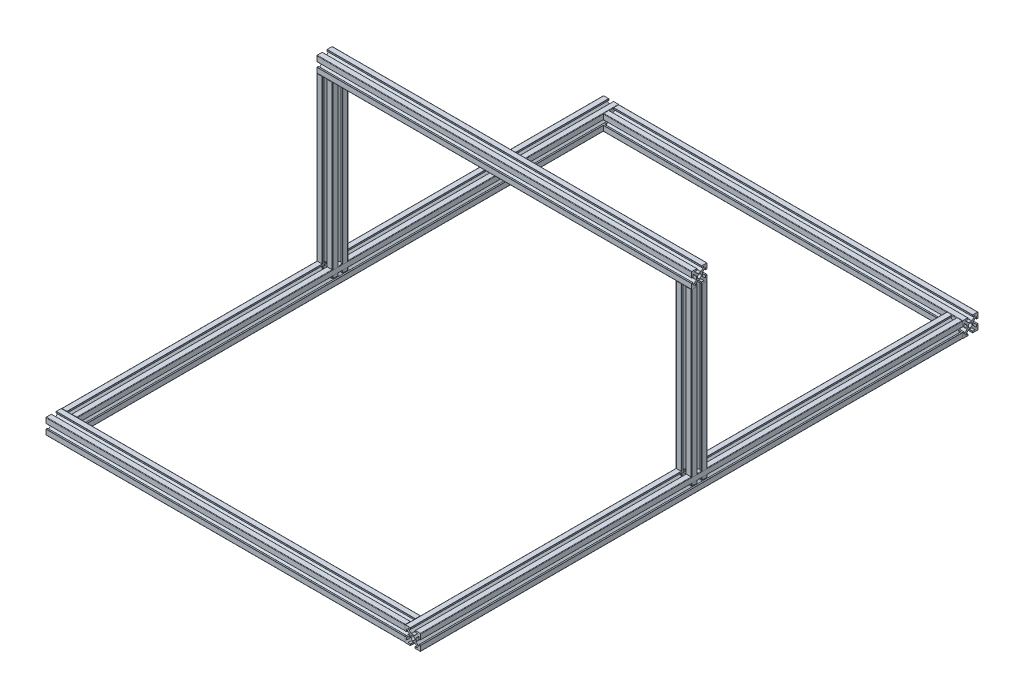
from build123d import *

# Parameters (mm, degrees)
T_SLOT_1010EXTXRUSION_1_DEPTH       = 352
T_SLOT_1010EXTXRUSION_1_DEPTH_BACK  = 1
SKETCH11_R                          = 1.25
SKETCH11_ON_SEGMENT_2_R             = 1.25
T_SLOT_1010EXTXRUSION_1_2_DEPTH     = 236
SKETCH11_ON_SEGMENT_3_R             = 1.25
T_SLOT_1010EXTXRUSION_1_3_DEPTH     = 353
SKETCH11_ON_SEGMENT_4_R             = 1.25
T_SLOT_1010EXTXRUSION_1_4_DEPTH     = 236
T_SLOT_1010EXTXRUSION_2_OUTLINE_R   = 1.25
T_SLOT_1010EXTXRUSION_2_DEPTH       = 109
T_SLOT_START                        = -120
T_SLOT_1010EXTXRUSION_2_2_OUTLINE_R = 1.25
T_SLOT_1010EXTXRUSION_2_2_DEPTH     = 240


# Read off the part's stored shape, not the designer's step: T-slot 1010EXTXRUSION(2)
with BuildPart() as part:
    # Sketch11 → T-slot 1010EXTXRUSION(1) (new, two sides: drawn at the far end of the back side and taken through both)
    with BuildSketch(Plane(origin=(-115, 0, 173.5), x_dir=(-1, 0, 0), z_dir=(0, 0, -1)).offset(-T_SLOT_1010EXTXRUSION_1_DEPTH_BACK)):
        with BuildLine():
            Line((-1.5, -4.1), (-1.5, -4.9))
            ThreePointArc((-1.5, -4.9), (-1.529289322, -4.970710678), (-1.6, -5))
            Line((-1.6, -5), (-4.7, -5))
            ThreePointArc((-4.7, -5), (-4.912132034, -4.912132034), (-5, -4.7))
            Line((-5, -4.7), (-5, -1.6))
            ThreePointArc((-5, -1.6), (-4.970710678, -1.529289322), (-4.9, -1.5))
            Line((-4.9, -1.5), (-4.1, -1.5))
            ThreePointArc((-4.1, -1.5), (-4.029289322, -1.529289322), (-4, -1.6))
            Line((-4, -1.6), (-4, -3.080761184))
            Line((-4, -3.080761184), (-2.067157288, -1.147918472))
            ThreePointArc((-2.067157288, -1.147918472), (-1.980448187, -1.018149132), (-1.95, -0.86507576))
            Line((-1.95, -0.86507576), (-1.95, 0.86507576))
            ThreePointArc((-1.95, 0.86507576), (-1.980448187, 1.018149132), (-2.067157288, 1.147918472))
            Line((-2.067157288, 1.147918472), (-3.94820158, 3.028962765))
            Line((-3.94820158, 3.028962765), (-4.000065469, 1.596382058))
            ThreePointArc((-4.000065469, 1.596382058), (-4.030580241, 1.528021551), (-4.1, 1.5))
            Line((-4.1, 1.5), (-4.9, 1.5))
            ThreePointArc((-4.9, 1.5), (-4.970710678, 1.529289322), (-5, 1.6))
            Line((-5, 1.6), (-5, 4.7))
            ThreePointArc((-5, 4.7), (-4.912132034, 4.912132034), (-4.7, 5))
            Line((-4.7, 5), (-1.6, 5))
            ThreePointArc((-1.6, 5), (-1.529289322, 4.970710678), (-1.5, 4.9))
            Line((-1.5, 4.9), (-1.5, 4.1))
            ThreePointArc((-1.5, 4.1), (-1.529289322, 4.029289322), (-1.6, 4))
            Line((-1.6, 4), (-3.080761184, 4))
            Line((-3.080761184, 4), (-1.147918472, 2.067157288))
            ThreePointArc((-1.147918472, 2.067157288), (-1.018149132, 1.980448187), (-0.86507576, 1.95))
            Line((-0.86507576, 1.95), (0.86507576, 1.95))
            ThreePointArc((0.86507576, 1.95), (1.018149132, 1.980448187), (1.147918472, 2.067157288))
            Line((1.147918472, 2.067157288), (3.080761184, 4))
            Line((3.080761184, 4), (1.6, 4))
            ThreePointArc((1.6, 4), (1.529289322, 4.029289322), (1.5, 4.1))
            Line((1.5, 4.1), (1.5, 4.9))
            ThreePointArc((1.5, 4.9), (1.529289322, 4.970710678), (1.6, 5))
            Line((1.6, 5), (4.7, 5))
            ThreePointArc((4.7, 5), (4.912132034, 4.912132034), (5, 4.7))
            Line((5, 4.7), (5, 1.6))
            ThreePointArc((5, 1.6), (4.970710678, 1.529289322), (4.9, 1.5))
            Line((4.9, 1.5), (4.1, 1.5))
            ThreePointArc((4.1, 1.5), (4.029289322, 1.529289322), (4, 1.6))
            Line((4, 1.6), (4, 3.080761184))
            Line((4, 3.080761184), (2.067157288, 1.147918472))
            ThreePointArc((2.067157288, 1.147918472), (1.980448187, 1.018149132), (1.95, 0.86507576))
            Line((1.95, 0.86507576), (1.95, -0.86507576))
            ThreePointArc((1.95, -0.86507576), (1.980448187, -1.018149132), (2.067157288, -1.147918472))
            Line((2.067157288, -1.147918472), (4, -3.080761184))
            Line((4, -3.080761184), (4, -1.6))
            ThreePointArc((4, -1.6), (4.029289322, -1.529289322), (4.1, -1.5))
            Line((4.1, -1.5), (4.9, -1.5))
            ThreePointArc((4.9, -1.5), (4.970710678, -1.529289322), (5, -1.6))
            Line((5, -1.6), (5, -4.7))
            ThreePointArc((5, -4.7), (4.912132034, -4.912132034), (4.7, -5))
            Line((4.7, -5), (1.6, -5))
            ThreePointArc((1.6, -5), (1.529289322, -4.970710678), (1.5, -4.9))
            Line((1.5, -4.9), (1.5, -4.1))
            ThreePointArc((1.5, -4.1), (1.529289322, -4.029289322), (1.6, -4))
            Line((1.6, -4), (3.080761184, -4))
            Line((3.080761184, -4), (1.147918472, -2.067157288))
            ThreePointArc((1.147918472, -2.067157288), (1.018149132, -1.980448187), (0.86507576, -1.95))
            Line((0.86507576, -1.95), (-0.86507576, -1.95))
            ThreePointArc((-0.86507576, -1.95), (-1.018149132, -1.980448187), (-1.147918472, -2.067157288))
            Line((-1.147918472, -2.067157288), (-3.080761184, -4))
            Line((-3.080761184, -4), (-1.6, -4))
            ThreePointArc((-1.6, -4), (-1.529289322, -4.029289322), (-1.5, -4.1))
        make_face()
        Circle(SKETCH11_R, mode=Mode.SUBTRACT)
    extrude(amount=T_SLOT_1010EXTXRUSION_1_DEPTH + T_SLOT_1010EXTXRUSION_1_DEPTH_BACK)

    # T-slot 1010EXTXRUSION(1) end butt 1
    split(bisect_by=Plane(origin=(-115, 0, 168.5), x_dir=(0, 1, 0), z_dir=(0, 0, -1)), keep=Keep.TOP)


with BuildPart() as body_2:
    # Sketch11 on segment 2 (carried to segment 2) → T-slot 1010EXTXRUSION_1 2 (new body)
    with BuildSketch(Plane(origin=(-116, 0, -173.5), x_dir=(0, 0, -1), z_dir=(1, 0, 0))):
        with BuildLine():
            Line((-1.5, -4.1), (-1.5, -4.9))
            ThreePointArc((-1.5, -4.9), (-1.529289322, -4.970710678), (-1.6, -5))
            Line((-1.6, -5), (-4.7, -5))
            ThreePointArc((-4.7, -5), (-4.912132034, -4.912132034), (-5, -4.7))
            Line((-5, -4.7), (-5, -1.6))
            ThreePointArc((-5, -1.6), (-4.970710678, -1.529289322), (-4.9, -1.5))
            Line((-4.9, -1.5), (-4.1, -1.5))
            ThreePointArc((-4.1, -1.5), (-4.029289322, -1.529289322), (-4, -1.6))
            Line((-4, -1.6), (-4, -3.080761184))
            Line((-4, -3.080761184), (-2.067157288, -1.147918472))
            ThreePointArc((-2.067157288, -1.147918472), (-1.980448187, -1.018149132), (-1.95, -0.86507576))
            Line((-1.95, -0.86507576), (-1.95, 0.86507576))
            ThreePointArc((-1.95, 0.86507576), (-1.980448187, 1.018149132), (-2.067157288, 1.147918472))
            Line((-2.067157288, 1.147918472), (-3.94820158, 3.028962765))
            Line((-3.94820158, 3.028962765), (-4.000065469, 1.596382058))
            ThreePointArc((-4.000065469, 1.596382058), (-4.030580241, 1.528021551), (-4.1, 1.5))
            Line((-4.1, 1.5), (-4.9, 1.5))
            ThreePointArc((-4.9, 1.5), (-4.970710678, 1.529289322), (-5, 1.6))
            Line((-5, 1.6), (-5, 4.7))
            ThreePointArc((-5, 4.7), (-4.912132034, 4.912132034), (-4.7, 5))
            Line((-4.7, 5), (-1.6, 5))
            ThreePointArc((-1.6, 5), (-1.529289322, 4.970710678), (-1.5, 4.9))
            Line((-1.5, 4.9), (-1.5, 4.1))
            ThreePointArc((-1.5, 4.1), (-1.529289322, 4.029289322), (-1.6, 4))
            Line((-1.6, 4), (-3.080761184, 4))
            Line((-3.080761184, 4), (-1.147918472, 2.067157288))
            ThreePointArc((-1.147918472, 2.067157288), (-1.018149132, 1.980448187), (-0.86507576, 1.95))
            Line((-0.86507576, 1.95), (0.86507576, 1.95))
            ThreePointArc((0.86507576, 1.95), (1.018149132, 1.980448187), (1.147918472, 2.067157288))
            Line((1.147918472, 2.067157288), (3.080761184, 4))
            Line((3.080761184, 4), (1.6, 4))
            ThreePointArc((1.6, 4), (1.529289322, 4.029289322), (1.5, 4.1))
            Line((1.5, 4.1), (1.5, 4.9))
            ThreePointArc((1.5, 4.9), (1.529289322, 4.970710678), (1.6, 5))
            Line((1.6, 5), (4.7, 5))
            ThreePointArc((4.7, 5), (4.912132034, 4.912132034), (5, 4.7))
            Line((5, 4.7), (5, 1.6))
            ThreePointArc((5, 1.6), (4.970710678, 1.529289322), (4.9, 1.5))
            Line((4.9, 1.5), (4.1, 1.5))
            ThreePointArc((4.1, 1.5), (4.029289322, 1.529289322), (4, 1.6))
            Line((4, 1.6), (4, 3.080761184))
            Line((4, 3.080761184), (2.067157288, 1.147918472))
            ThreePointArc((2.067157288, 1.147918472), (1.980448187, 1.018149132), (1.95, 0.86507576))
            Line((1.95, 0.86507576), (1.95, -0.86507576))
            ThreePointArc((1.95, -0.86507576), (1.980448187, -1.018149132), (2.067157288, -1.147918472))
            Line((2.067157288, -1.147918472), (4, -3.080761184))
            Line((4, -3.080761184), (4, -1.6))
            ThreePointArc((4, -1.6), (4.029289322, -1.529289322), (4.1, -1.5))
            Line((4.1, -1.5), (4.9, -1.5))
            ThreePointArc((4.9, -1.5), (4.970710678, -1.529289322), (5, -1.6))
            Line((5, -1.6), (5, -4.7))
            ThreePointArc((5, -4.7), (4.912132034, -4.912132034), (4.7, -5))
            Line((4.7, -5), (1.6, -5))
            ThreePointArc((1.6, -5), (1.529289322, -4.970710678), (1.5, -4.9))
            Line((1.5, -4.9), (1.5, -4.1))
            ThreePointArc((1.5, -4.1), (1.529289322, -4.029289322), (1.6, -4))
            Line((1.6, -4), (3.080761184, -4))
            Line((3.080761184, -4), (1.147918472, -2.067157288))
            ThreePointArc((1.147918472, -2.067157288), (1.018149132, -1.980448187), (0.86507576, -1.95))
            Line((0.86507576, -1.95), (-0.86507576, -1.95))
            ThreePointArc((-0.86507576, -1.95), (-1.018149132, -1.980448187), (-1.147918472, -2.067157288))
            Line((-1.147918472, -2.067157288), (-3.080761184, -4))
            Line((-3.080761184, -4), (-1.6, -4))
            ThreePointArc((-1.6, -4), (-1.529289322, -4.029289322), (-1.5, -4.1))
        make_face()
        Circle(SKETCH11_ON_SEGMENT_2_R, mode=Mode.SUBTRACT)
    extrude(amount=T_SLOT_1010EXTXRUSION_1_2_DEPTH)

    # T-slot 1010EXTXRUSION_1 2 end butt 1
    split(bisect_by=Plane(origin=(-110, 0, -173.5), x_dir=(0, 1, 0), z_dir=(1, 0, 0)), keep=Keep.TOP)


with BuildPart() as body_3:
    # Sketch11 on segment 3 (carried to segment 3) → T-slot 1010EXTXRUSION_1 3 (new body)
    with BuildSketch(Plane(origin=(115, 0, -174.5), x_dir=(1, 0, 0), z_dir=(0, 0, 1))):
        with BuildLine():
            Line((-1.5, -4.1), (-1.5, -4.9))
            ThreePointArc((-1.5, -4.9), (-1.529289322, -4.970710678), (-1.6, -5))
            Line((-1.6, -5), (-4.7, -5))
            ThreePointArc((-4.7, -5), (-4.912132034, -4.912132034), (-5, -4.7))
            Line((-5, -4.7), (-5, -1.6))
            ThreePointArc((-5, -1.6), (-4.970710678, -1.529289322), (-4.9, -1.5))
            Line((-4.9, -1.5), (-4.1, -1.5))
            ThreePointArc((-4.1, -1.5), (-4.029289322, -1.529289322), (-4, -1.6))
            Line((-4, -1.6), (-4, -3.080761184))
            Line((-4, -3.080761184), (-2.067157288, -1.147918472))
            ThreePointArc((-2.067157288, -1.147918472), (-1.980448187, -1.018149132), (-1.95, -0.86507576))
            Line((-1.95, -0.86507576), (-1.95, 0.86507576))
            ThreePointArc((-1.95, 0.86507576), (-1.980448187, 1.018149132), (-2.067157288, 1.147918472))
            Line((-2.067157288, 1.147918472), (-3.94820158, 3.028962765))
            Line((-3.94820158, 3.028962765), (-4.000065469, 1.596382058))
            ThreePointArc((-4.000065469, 1.596382058), (-4.030580241, 1.528021551), (-4.1, 1.5))
            Line((-4.1, 1.5), (-4.9, 1.5))
            ThreePointArc((-4.9, 1.5), (-4.970710678, 1.529289322), (-5, 1.6))
            Line((-5, 1.6), (-5, 4.7))
            ThreePointArc((-5, 4.7), (-4.912132034, 4.912132034), (-4.7, 5))
            Line((-4.7, 5), (-1.6, 5))
            ThreePointArc((-1.6, 5), (-1.529289322, 4.970710678), (-1.5, 4.9))
            Line((-1.5, 4.9), (-1.5, 4.1))
            ThreePointArc((-1.5, 4.1), (-1.529289322, 4.029289322), (-1.6, 4))
            Line((-1.6, 4), (-3.080761184, 4))
            Line((-3.080761184, 4), (-1.147918472, 2.067157288))
            ThreePointArc((-1.147918472, 2.067157288), (-1.018149132, 1.980448187), (-0.86507576, 1.95))
            Line((-0.86507576, 1.95), (0.86507576, 1.95))
            ThreePointArc((0.86507576, 1.95), (1.018149132, 1.980448187), (1.147918472, 2.067157288))
            Line((1.147918472, 2.067157288), (3.080761184, 4))
            Line((3.080761184, 4), (1.6, 4))
            ThreePointArc((1.6, 4), (1.529289322, 4.029289322), (1.5, 4.1))
            Line((1.5, 4.1), (1.5, 4.9))
            ThreePointArc((1.5, 4.9), (1.529289322, 4.970710678), (1.6, 5))
            Line((1.6, 5), (4.7, 5))
            ThreePointArc((4.7, 5), (4.912132034, 4.912132034), (5, 4.7))
            Line((5, 4.7), (5, 1.6))
            ThreePointArc((5, 1.6), (4.970710678, 1.529289322), (4.9, 1.5))
            Line((4.9, 1.5), (4.1, 1.5))
            ThreePointArc((4.1, 1.5), (4.029289322, 1.529289322), (4, 1.6))
            Line((4, 1.6), (4, 3.080761184))
            Line((4, 3.080761184), (2.067157288, 1.147918472))
            ThreePointArc((2.067157288, 1.147918472), (1.980448187, 1.018149132), (1.95, 0.86507576))
            Line((1.95, 0.86507576), (1.95, -0.86507576))
            ThreePointArc((1.95, -0.86507576), (1.980448187, -1.018149132), (2.067157288, -1.147918472))
            Line((2.067157288, -1.147918472), (4, -3.080761184))
            Line((4, -3.080761184), (4, -1.6))
            ThreePointArc((4, -1.6), (4.029289322, -1.529289322), (4.1, -1.5))
            Line((4.1, -1.5), (4.9, -1.5))
            ThreePointArc((4.9, -1.5), (4.970710678, -1.529289322), (5, -1.6))
            Line((5, -1.6), (5, -4.7))
            ThreePointArc((5, -4.7), (4.912132034, -4.912132034), (4.7, -5))
            Line((4.7, -5), (1.6, -5))
            ThreePointArc((1.6, -5), (1.529289322, -4.970710678), (1.5, -4.9))
            Line((1.5, -4.9), (1.5, -4.1))
            ThreePointArc((1.5, -4.1), (1.529289322, -4.029289322), (1.6, -4))
            Line((1.6, -4), (3.080761184, -4))
            Line((3.080761184, -4), (1.147918472, -2.067157288))
            ThreePointArc((1.147918472, -2.067157288), (1.018149132, -1.980448187), (0.86507576, -1.95))
            Line((0.86507576, -1.95), (-0.86507576, -1.95))
            ThreePointArc((-0.86507576, -1.95), (-1.018149132, -1.980448187), (-1.147918472, -2.067157288))
            Line((-1.147918472, -2.067157288), (-3.080761184, -4))
            Line((-3.080761184, -4), (-1.6, -4))
            ThreePointArc((-1.6, -4), (-1.529289322, -4.029289322), (-1.5, -4.1))
        make_face()
        Circle(SKETCH11_ON_SEGMENT_3_R, mode=Mode.SUBTRACT)
    extrude(amount=T_SLOT_1010EXTXRUSION_1_3_DEPTH)

    # T-slot 1010EXTXRUSION_1 3 end butt 1
    split(bisect_by=Plane(origin=(115, 0, -168.5), x_dir=(0, -1, 0), z_dir=(0, 0, 1)), keep=Keep.TOP)


with BuildPart() as body_4:
    # Sketch11 on segment 4 (carried to segment 4) → T-slot 1010EXTXRUSION_1 4 (new body)
    with BuildSketch(Plane(origin=(116, 0, 173.5), x_dir=(0, 0, 1), z_dir=(-1, 0, 0))):
        with BuildLine():
            Line((-1.5, -4.1), (-1.5, -4.9))
            ThreePointArc((-1.5, -4.9), (-1.529289322, -4.970710678), (-1.6, -5))
            Line((-1.6, -5), (-4.7, -5))
            ThreePointArc((-4.7, -5), (-4.912132034, -4.912132034), (-5, -4.7))
            Line((-5, -4.7), (-5, -1.6))
            ThreePointArc((-5, -1.6), (-4.970710678, -1.529289322), (-4.9, -1.5))
            Line((-4.9, -1.5), (-4.1, -1.5))
            ThreePointArc((-4.1, -1.5), (-4.029289322, -1.529289322), (-4, -1.6))
            Line((-4, -1.6), (-4, -3.080761184))
            Line((-4, -3.080761184), (-2.067157288, -1.147918472))
            ThreePointArc((-2.067157288, -1.147918472), (-1.980448187, -1.018149132), (-1.95, -0.86507576))
            Line((-1.95, -0.86507576), (-1.95, 0.86507576))
            ThreePointArc((-1.95, 0.86507576), (-1.980448187, 1.018149132), (-2.067157288, 1.147918472))
            Line((-2.067157288, 1.147918472), (-3.94820158, 3.028962765))
            Line((-3.94820158, 3.028962765), (-4.000065469, 1.596382058))
            ThreePointArc((-4.000065469, 1.596382058), (-4.030580241, 1.528021551), (-4.1, 1.5))
            Line((-4.1, 1.5), (-4.9, 1.5))
            ThreePointArc((-4.9, 1.5), (-4.970710678, 1.529289322), (-5, 1.6))
            Line((-5, 1.6), (-5, 4.7))
            ThreePointArc((-5, 4.7), (-4.912132034, 4.912132034), (-4.7, 5))
            Line((-4.7, 5), (-1.6, 5))
            ThreePointArc((-1.6, 5), (-1.529289322, 4.970710678), (-1.5, 4.9))
            Line((-1.5, 4.9), (-1.5, 4.1))
            ThreePointArc((-1.5, 4.1), (-1.529289322, 4.029289322), (-1.6, 4))
            Line((-1.6, 4), (-3.080761184, 4))
            Line((-3.080761184, 4), (-1.147918472, 2.067157288))
            ThreePointArc((-1.147918472, 2.067157288), (-1.018149132, 1.980448187), (-0.86507576, 1.95))
            Line((-0.86507576, 1.95), (0.86507576, 1.95))
            ThreePointArc((0.86507576, 1.95), (1.018149132, 1.980448187), (1.147918472, 2.067157288))
            Line((1.147918472, 2.067157288), (3.080761184, 4))
            Line((3.080761184, 4), (1.6, 4))
            ThreePointArc((1.6, 4), (1.529289322, 4.029289322), (1.5, 4.1))
            Line((1.5, 4.1), (1.5, 4.9))
            ThreePointArc((1.5, 4.9), (1.529289322, 4.970710678), (1.6, 5))
            Line((1.6, 5), (4.7, 5))
            ThreePointArc((4.7, 5), (4.912132034, 4.912132034), (5, 4.7))
            Line((5, 4.7), (5, 1.6))
            ThreePointArc((5, 1.6), (4.970710678, 1.529289322), (4.9, 1.5))
            Line((4.9, 1.5), (4.1, 1.5))
            ThreePointArc((4.1, 1.5), (4.029289322, 1.529289322), (4, 1.6))
            Line((4, 1.6), (4, 3.080761184))
            Line((4, 3.080761184), (2.067157288, 1.147918472))
            ThreePointArc((2.067157288, 1.147918472), (1.980448187, 1.018149132), (1.95, 0.86507576))
            Line((1.95, 0.86507576), (1.95, -0.86507576))
            ThreePointArc((1.95, -0.86507576), (1.980448187, -1.018149132), (2.067157288, -1.147918472))
            Line((2.067157288, -1.147918472), (4, -3.080761184))
            Line((4, -3.080761184), (4, -1.6))
            ThreePointArc((4, -1.6), (4.029289322, -1.529289322), (4.1, -1.5))
            Line((4.1, -1.5), (4.9, -1.5))
            ThreePointArc((4.9, -1.5), (4.970710678, -1.529289322), (5, -1.6))
            Line((5, -1.6), (5, -4.7))
            ThreePointArc((5, -4.7), (4.912132034, -4.912132034), (4.7, -5))
            Line((4.7, -5), (1.6, -5))
            ThreePointArc((1.6, -5), (1.529289322, -4.970710678), (1.5, -4.9))
            Line((1.5, -4.9), (1.5, -4.1))
            ThreePointArc((1.5, -4.1), (1.529289322, -4.029289322), (1.6, -4))
            Line((1.6, -4), (3.080761184, -4))
            Line((3.080761184, -4), (1.147918472, -2.067157288))
            ThreePointArc((1.147918472, -2.067157288), (1.018149132, -1.980448187), (0.86507576, -1.95))
            Line((0.86507576, -1.95), (-0.86507576, -1.95))
            ThreePointArc((-0.86507576, -1.95), (-1.018149132, -1.980448187), (-1.147918472, -2.067157288))
            Line((-1.147918472, -2.067157288), (-3.080761184, -4))
            Line((-3.080761184, -4), (-1.6, -4))
            ThreePointArc((-1.6, -4), (-1.529289322, -4.029289322), (-1.5, -4.1))
        make_face()
        Circle(SKETCH11_ON_SEGMENT_4_R, mode=Mode.SUBTRACT)
    extrude(amount=T_SLOT_1010EXTXRUSION_1_4_DEPTH)

    # T-slot 1010EXTXRUSION_1 4 end butt 1
    split(bisect_by=Plane(origin=(110, 0, 173.5), x_dir=(0, -1, 0), z_dir=(-1, 0, 0)), keep=Keep.TOP)


with BuildPart() as body_5:
    # T-slot 1010EXTXRUSION(2) outline → T-slot 1010EXTXRUSION(2) (new body)
    # profile 1 of 2: a face of its own
    with BuildSketch(Plane(origin=(0, 0, 0), x_dir=(1, 0, 0), z_dir=(0, 1, 0))):
        with BuildLine():
            ThreePointArc((-110.3, -5), (-110.087867966, -4.912132034), (-110, -4.7))
            Line((-110, -4.7), (-110, -1.6))
            ThreePointArc((-110, -1.6), (-110.029289322, -1.529289322), (-110.1, -1.5))
            Line((-110.1, -1.5), (-110.9, -1.5))
            ThreePointArc((-110.9, -1.5), (-110.970710678, -1.529289322), (-111, -1.6))
            Line((-111, -1.6), (-111, -3.080761184))
            Line((-111, -3.080761184), (-112.932842712, -1.147918472))
            ThreePointArc((-112.932842712, -1.147918472), (-113.019551813, -1.018149133), (-113.05, -0.86507576))
            Line((-113.05, -0.86507576), (-113.05, 0.86507576))
            ThreePointArc((-113.05, 0.86507576), (-113.019551813, 1.018149133), (-112.932842712, 1.147918472))
            Line((-112.932842712, 1.147918472), (-111, 3.080761184))
            Line((-111, 3.080761184), (-111, 1.6))
            ThreePointArc((-111, 1.6), (-110.970710678, 1.529289322), (-110.9, 1.5))
            Line((-110.9, 1.5), (-110.1, 1.5))
            ThreePointArc((-110.1, 1.5), (-110.029289322, 1.529289322), (-110, 1.6))
            Line((-110, 1.6), (-110, 4.7))
            ThreePointArc((-110, 4.7), (-110.087867966, 4.912132034), (-110.3, 5))
            Line((-110.3, 5), (-113.4, 5))
            ThreePointArc((-113.4, 5), (-113.470710678, 4.970710678), (-113.5, 4.9))
            Line((-113.5, 4.9), (-113.5, 4.1))
            ThreePointArc((-113.5, 4.1), (-113.471978449, 4.030580241), (-113.403617942, 4.000065469))
            Line((-113.403617942, 4.000065469), (-111.971037235, 3.94820158))
            Line((-111.971037235, 3.94820158), (-113.852081528, 2.067157288))
            ThreePointArc((-113.852081528, 2.067157288), (-113.981850867, 1.980448187), (-114.13492424, 1.95))
            Line((-114.13492424, 1.95), (-115.86507576, 1.95))
            ThreePointArc((-115.86507576, 1.95), (-116.018149133, 1.980448187), (-116.147918472, 2.067157288))
            Line((-116.147918472, 2.067157288), (-118.080761184, 4))
            Line((-118.080761184, 4), (-116.6, 4))
            ThreePointArc((-116.6, 4), (-116.529289322, 4.029289322), (-116.5, 4.1))
            Line((-116.5, 4.1), (-116.5, 4.9))
            ThreePointArc((-116.5, 4.9), (-116.529289322, 4.970710678), (-116.6, 5))
            Line((-116.6, 5), (-119.7, 5))
            ThreePointArc((-119.7, 5), (-119.912132034, 4.912132034), (-120, 4.7))
            Line((-120, 4.7), (-120, 1.6))
            ThreePointArc((-120, 1.6), (-119.970710678, 1.529289322), (-119.9, 1.5))
            Line((-119.9, 1.5), (-119.1, 1.5))
            ThreePointArc((-119.1, 1.5), (-119.029289322, 1.529289322), (-119, 1.6))
            Line((-119, 1.6), (-119, 3.080761184))
            Line((-119, 3.080761184), (-117.067157288, 1.147918472))
            ThreePointArc((-117.067157288, 1.147918472), (-116.980448187, 1.018149133), (-116.95, 0.86507576))
            Line((-116.95, 0.86507576), (-116.95, -0.86507576))
            ThreePointArc((-116.95, -0.86507576), (-116.980448187, -1.018149133), (-117.067157288, -1.147918472))
            Line((-117.067157288, -1.147918472), (-119, -3.080761184))
            Line((-119, -3.080761184), (-119, -1.6))
            ThreePointArc((-119, -1.6), (-119.029289322, -1.529289322), (-119.1, -1.5))
            Line((-119.1, -1.5), (-119.9, -1.5))
            ThreePointArc((-119.9, -1.5), (-119.970710678, -1.529289322), (-120, -1.6))
            Line((-120, -1.6), (-120, -4.7))
            ThreePointArc((-120, -4.7), (-119.912132034, -4.912132034), (-119.7, -5))
            Line((-119.7, -5), (-116.6, -5))
            ThreePointArc((-116.6, -5), (-116.529289322, -4.970710678), (-116.5, -4.9))
            Line((-116.5, -4.9), (-116.5, -4.1))
            ThreePointArc((-116.5, -4.1), (-116.529289322, -4.029289322), (-116.6, -4))
            Line((-116.6, -4), (-118.080761184, -4))
            Line((-118.080761184, -4), (-116.147918472, -2.067157288))
            ThreePointArc((-116.147918472, -2.067157288), (-116.018149133, -1.980448187), (-115.86507576, -1.95))
            Line((-115.86507576, -1.95), (-114.13492424, -1.95))
            ThreePointArc((-114.13492424, -1.95), (-113.981850867, -1.980448187), (-113.852081528, -2.067157288))
            Line((-113.852081528, -2.067157288), (-111.919238816, -4))
            Line((-111.919238816, -4), (-113.4, -4))
            ThreePointArc((-113.4, -4), (-113.470710678, -4.029289322), (-113.5, -4.1))
            Line((-113.5, -4.1), (-113.5, -4.9))
            ThreePointArc((-113.5, -4.9), (-113.470710678, -4.970710678), (-113.4, -5))
            Line((-113.4, -5), (-110.3, -5))
        make_face()
        with Locations((-115, 0)):
            Circle(T_SLOT_1010EXTXRUSION_2_OUTLINE_R, mode=Mode.SUBTRACT)
    # profile 2 of 2: a face of its own
    with BuildSketch(Plane(origin=(0, 0, 0), x_dir=(1, 0, 0), z_dir=(0, 1, 0))):
        with BuildLine():
            Line((110.9, -1.5), (110.1, -1.5))
            ThreePointArc((110.1, -1.5), (110.029289322, -1.529289322), (110, -1.6))
            Line((110, -1.6), (110, -4.7))
            ThreePointArc((110, -4.7), (110.087867966, -4.912132034), (110.3, -5))
            Line((110.3, -5), (113.4, -5))
            ThreePointArc((113.4, -5), (113.470710678, -4.970710678), (113.5, -4.9))
            Line((113.5, -4.9), (113.5, -4.1))
            ThreePointArc((113.5, -4.1), (113.470710678, -4.029289322), (113.4, -4))
            Line((113.4, -4), (111.919238816, -4))
            Line((111.919238816, -4), (113.852081528, -2.067157288))
            ThreePointArc((113.852081528, -2.067157288), (113.981850867, -1.980448187), (114.13492424, -1.95))
            Line((114.13492424, -1.95), (115.86507576, -1.95))
            ThreePointArc((115.86507576, -1.95), (116.018149133, -1.980448187), (116.147918472, -2.067157288))
            Line((116.147918472, -2.067157288), (118.080761184, -4))
            Line((118.080761184, -4), (116.6, -4))
            ThreePointArc((116.6, -4), (116.529289322, -4.029289322), (116.5, -4.1))
            Line((116.5, -4.1), (116.5, -4.9))
            ThreePointArc((116.5, -4.9), (116.529289322, -4.970710678), (116.6, -5))
            Line((116.6, -5), (119.7, -5))
            ThreePointArc((119.7, -5), (119.912132034, -4.912132034), (120, -4.7))
            Line((120, -4.7), (120, -1.6))
            ThreePointArc((120, -1.6), (119.970710678, -1.529289322), (119.9, -1.5))
            Line((119.9, -1.5), (119.1, -1.5))
            ThreePointArc((119.1, -1.5), (119.029289322, -1.529289322), (119, -1.6))
            Line((119, -1.6), (119, -3.080761184))
            Line((119, -3.080761184), (117.067157288, -1.147918472))
            ThreePointArc((117.067157288, -1.147918472), (116.980448187, -1.018149133), (116.95, -0.86507576))
            Line((116.95, -0.86507576), (116.95, 0.86507576))
            ThreePointArc((116.95, 0.86507576), (116.980448187, 1.018149133), (117.067157288, 1.147918472))
            Line((117.067157288, 1.147918472), (119, 3.080761184))
            Line((119, 3.080761184), (119, 1.6))
            ThreePointArc((119, 1.6), (119.029289322, 1.529289322), (119.1, 1.5))
            Line((119.1, 1.5), (119.9, 1.5))
            ThreePointArc((119.9, 1.5), (119.970710678, 1.529289322), (120, 1.6))
            Line((120, 1.6), (120, 4.7))
            ThreePointArc((120, 4.7), (119.912132034, 4.912132034), (119.7, 5))
            Line((119.7, 5), (116.6, 5))
            ThreePointArc((116.6, 5), (116.529289322, 4.970710678), (116.5, 4.9))
            Line((116.5, 4.9), (116.5, 4.1))
            ThreePointArc((116.5, 4.1), (116.529289322, 4.029289322), (116.6, 4))
            Line((116.6, 4), (118.080761184, 4))
            Line((118.080761184, 4), (116.147918472, 2.067157288))
            ThreePointArc((116.147918472, 2.067157288), (116.018149133, 1.980448187), (115.86507576, 1.95))
            Line((115.86507576, 1.95), (114.13492424, 1.95))
            ThreePointArc((114.13492424, 1.95), (113.981850867, 1.980448187), (113.852081528, 2.067157288))
            Line((113.852081528, 2.067157288), (111.971037235, 3.94820158))
            Line((111.971037235, 3.94820158), (113.403617942, 4.000065469))
            ThreePointArc((113.403617942, 4.000065469), (113.471978449, 4.030580241), (113.5, 4.1))
            Line((113.5, 4.1), (113.5, 4.9))
            ThreePointArc((113.5, 4.9), (113.470710678, 4.970710678), (113.4, 5))
            Line((113.4, 5), (110.3, 5))
            ThreePointArc((110.3, 5), (110.087867966, 4.912132034), (110, 4.7))
            Line((110, 4.7), (110, 1.6))
            ThreePointArc((110, 1.6), (110.029289322, 1.529289322), (110.1, 1.5))
            Line((110.1, 1.5), (110.9, 1.5))
            ThreePointArc((110.9, 1.5), (110.970710678, 1.529289322), (111, 1.6))
            Line((111, 1.6), (111, 3.080761184))
            Line((111, 3.080761184), (112.932842712, 1.147918472))
            ThreePointArc((112.932842712, 1.147918472), (113.019551813, 1.018149133), (113.05, 0.86507576))
            Line((113.05, 0.86507576), (113.05, -0.86507576))
            ThreePointArc((113.05, -0.86507576), (113.019551813, -1.018149133), (112.932842712, -1.147918472))
            Line((112.932842712, -1.147918472), (111, -3.080761184))
            Line((111, -3.080761184), (111, -1.6))
            ThreePointArc((111, -1.6), (110.970710678, -1.529289322), (110.9, -1.5))
        make_face()
        with Locations((115, 0)):
            Circle(T_SLOT_1010EXTXRUSION_2_OUTLINE_R, mode=Mode.SUBTRACT)
    extrude(amount=T_SLOT_1010EXTXRUSION_2_DEPTH)


with BuildPart() as body_6:
    # T-slot 1010EXTXRUSION_2 2 outline → T-slot 1010EXTXRUSION_2 2 (new body)
    with BuildSketch(Plane.YZ.offset(T_SLOT_START)):
        with BuildLine():
            Line((109.1, 1.5), (109.9, 1.5))
            ThreePointArc((109.9, 1.5), (109.970710678, 1.529289322), (110, 1.6))
            Line((110, 1.6), (110, 3.080761184))
            Line((110, 3.080761184), (111.932842712, 1.147918472))
            ThreePointArc((111.932842712, 1.147918472), (112.019551813, 1.018149133), (112.05, 0.86507576))
            Line((112.05, 0.86507576), (112.05, -0.86507576))
            ThreePointArc((112.05, -0.86507576), (112.019551813, -1.018149133), (111.932842712, -1.147918472))
            Line((111.932842712, -1.147918472), (110, -3.080761184))
            Line((110, -3.080761184), (110, -1.6))
            ThreePointArc((110, -1.6), (109.970710678, -1.529289322), (109.9, -1.5))
            Line((109.9, -1.5), (109.1, -1.5))
            ThreePointArc((109.1, -1.5), (109.029289322, -1.529289322), (109, -1.6))
            Line((109, -1.6), (109, -4.7))
            ThreePointArc((109, -4.7), (109.087867966, -4.912132034), (109.3, -5))
            Line((109.3, -5), (112.4, -5))
            ThreePointArc((112.4, -5), (112.470710678, -4.970710678), (112.5, -4.9))
            Line((112.5, -4.9), (112.5, -4.1))
            ThreePointArc((112.5, -4.1), (112.471978449, -4.030580241), (112.403617942, -4.000065469))
            Line((112.403617942, -4.000065469), (110.971037235, -3.94820158))
            Line((110.971037235, -3.94820158), (112.852081528, -2.067157288))
            ThreePointArc((112.852081528, -2.067157288), (112.981850867, -1.980448187), (113.13492424, -1.95))
            Line((113.13492424, -1.95), (114.86507576, -1.95))
            ThreePointArc((114.86507576, -1.95), (115.018149133, -1.980448187), (115.147918472, -2.067157288))
            Line((115.147918472, -2.067157288), (117.080761184, -4))
            Line((117.080761184, -4), (115.6, -4))
            ThreePointArc((115.6, -4), (115.529289322, -4.029289322), (115.5, -4.1))
            Line((115.5, -4.1), (115.5, -4.9))
            ThreePointArc((115.5, -4.9), (115.529289322, -4.970710678), (115.6, -5))
            Line((115.6, -5), (118.7, -5))
            ThreePointArc((118.7, -5), (118.912132034, -4.912132034), (119, -4.7))
            Line((119, -4.7), (119, -1.6))
            ThreePointArc((119, -1.6), (118.970710678, -1.529289322), (118.9, -1.5))
            Line((118.9, -1.5), (118.1, -1.5))
            ThreePointArc((118.1, -1.5), (118.029289322, -1.529289322), (118, -1.6))
            Line((118, -1.6), (118, -3.080761184))
            Line((118, -3.080761184), (116.067157288, -1.147918472))
            ThreePointArc((116.067157288, -1.147918472), (115.980448187, -1.018149133), (115.95, -0.86507576))
            Line((115.95, -0.86507576), (115.95, 0.86507576))
            ThreePointArc((115.95, 0.86507576), (115.980448187, 1.018149133), (116.067157288, 1.147918472))
            Line((116.067157288, 1.147918472), (118, 3.080761184))
            Line((118, 3.080761184), (118, 1.6))
            ThreePointArc((118, 1.6), (118.029289322, 1.529289322), (118.1, 1.5))
            Line((118.1, 1.5), (118.9, 1.5))
            ThreePointArc((118.9, 1.5), (118.970710678, 1.529289322), (119, 1.6))
            Line((119, 1.6), (119, 4.7))
            ThreePointArc((119, 4.7), (118.912132034, 4.912132034), (118.7, 5))
            Line((118.7, 5), (115.6, 5))
            ThreePointArc((115.6, 5), (115.529289322, 4.970710678), (115.5, 4.9))
            Line((115.5, 4.9), (115.5, 4.1))
            ThreePointArc((115.5, 4.1), (115.529289322, 4.029289322), (115.6, 4))
            Line((115.6, 4), (117.080761184, 4))
            Line((117.080761184, 4), (115.147918472, 2.067157288))
            ThreePointArc((115.147918472, 2.067157288), (115.018149133, 1.980448187), (114.86507576, 1.95))
            Line((114.86507576, 1.95), (113.13492424, 1.95))
            ThreePointArc((113.13492424, 1.95), (112.981850867, 1.980448187), (112.852081528, 2.067157288))
            Line((112.852081528, 2.067157288), (110.919238816, 4))
            Line((110.919238816, 4), (112.4, 4))
            ThreePointArc((112.4, 4), (112.470710678, 4.029289322), (112.5, 4.1))
            Line((112.5, 4.1), (112.5, 4.9))
            ThreePointArc((112.5, 4.9), (112.470710678, 4.970710678), (112.4, 5))
            Line((112.4, 5), (109.3, 5))
            ThreePointArc((109.3, 5), (109.087867966, 4.912132034), (109, 4.7))
            Line((109, 4.7), (109, 1.6))
            ThreePointArc((109, 1.6), (109.029289322, 1.529289322), (109.1, 1.5))
        make_face()
        with Locations((114, 0)):
            Circle(T_SLOT_1010EXTXRUSION_2_2_OUTLINE_R, mode=Mode.SUBTRACT)
    extrude(amount=T_SLOT_1010EXTXRUSION_2_2_DEPTH)


solid = Compound([part.part, body_2.part, body_3.part, body_4.part, body_5.part, body_6.part])
